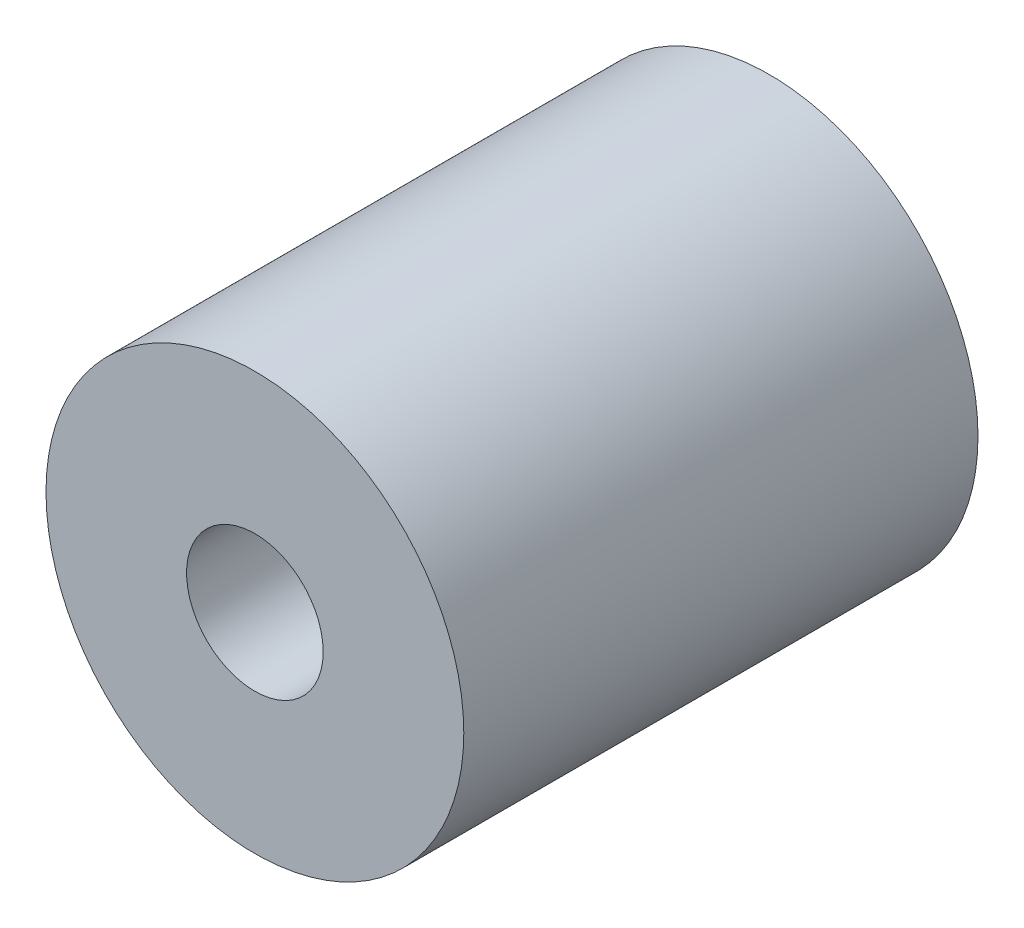
from build123d import *

# Parameters (mm, degrees)
SKETCH1_W           = 4.375
SKETCH1_H           = 3.75
SKETCH2_R           = 6.5
SKETCH2_R_2         = 2.125
BOSS_EXTRUDE1_DEPTH = 12.25


with BuildPart() as part:
    # Sketch1 → Revolve1 (revolve)
    with BuildSketch(Plane(origin=(0, 0, 0), x_dir=(1, 0, 0), z_dir=(0, 1, 0))):
        with Locations((4.3125, -1.875)):
            Rectangle(SKETCH1_W, SKETCH1_H)
    revolve(axis=Axis((0, 0, 0), (0, 0, 1)))

    # Sketch2 → Boss-Extrude1 (add)
    with BuildSketch(Plane.XY.offset(3.75)):
        Circle(SKETCH2_R)
        Circle(SKETCH2_R_2, mode=Mode.SUBTRACT)
    extrude(amount=BOSS_EXTRUDE1_DEPTH)


solid = part.part
